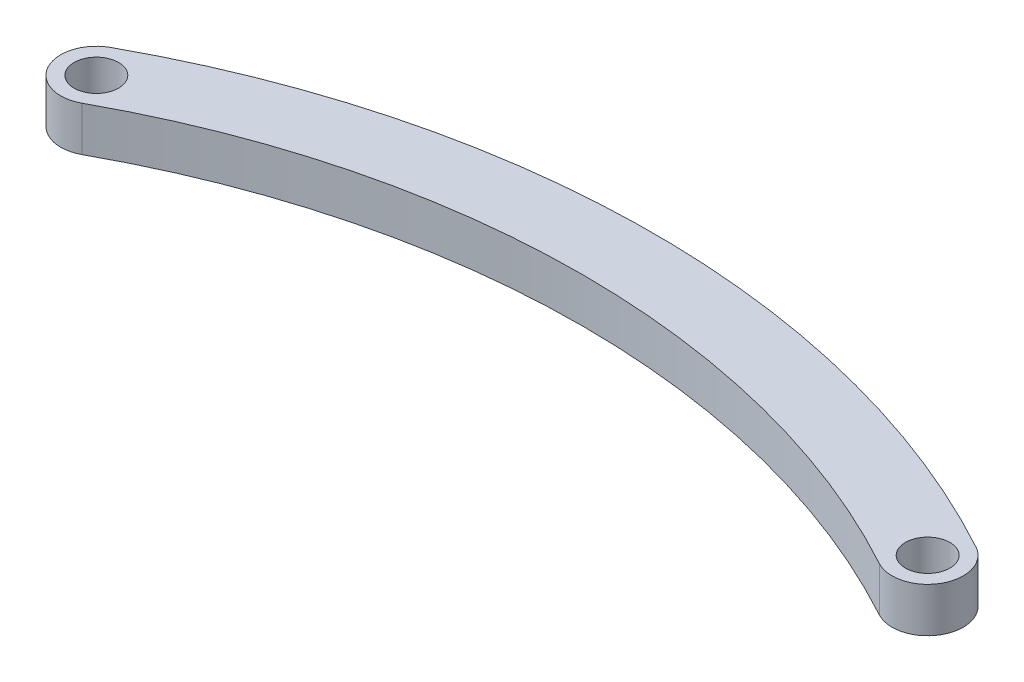
from build123d import *

# Parameters (mm, degrees)
ESQUISSE1_R        = 1.875
BOSS_EXTRU_1_DEPTH = 3.75


with BuildPart() as part:
    # Esquisse1 → Boss.-Extru.1 (new body)
    with BuildSketch(Plane(origin=(0, 0, 0), x_dir=(1, 0, 0), z_dir=(0, 1, 0))):
        with BuildLine():
            ThreePointArc((-36.438356038, 2.632704296), (-37.632704242, -1.438356135), (-33.561643767, -2.632704189))
            ThreePointArc((-33.561643767, -2.632704189), (6.8e-08, 5.937530488), (33.561643886, -2.632704254))
            ThreePointArc((33.561643886, -2.632704254), (37.632704286, -1.438356055), (36.438355996, 2.632704318))
            ThreePointArc((36.438355996, 2.632704318), (-2.4e-08, 11.937530488), (-36.438356038, 2.632704296))
        make_face()
        with Locations((-35, 0)):
            Circle(ESQUISSE1_R, mode=Mode.SUBTRACT)
        with Locations((35, 0)):
            Circle(ESQUISSE1_R, mode=Mode.SUBTRACT)
    extrude(amount=BOSS_EXTRU_1_DEPTH)


solid = part.part
